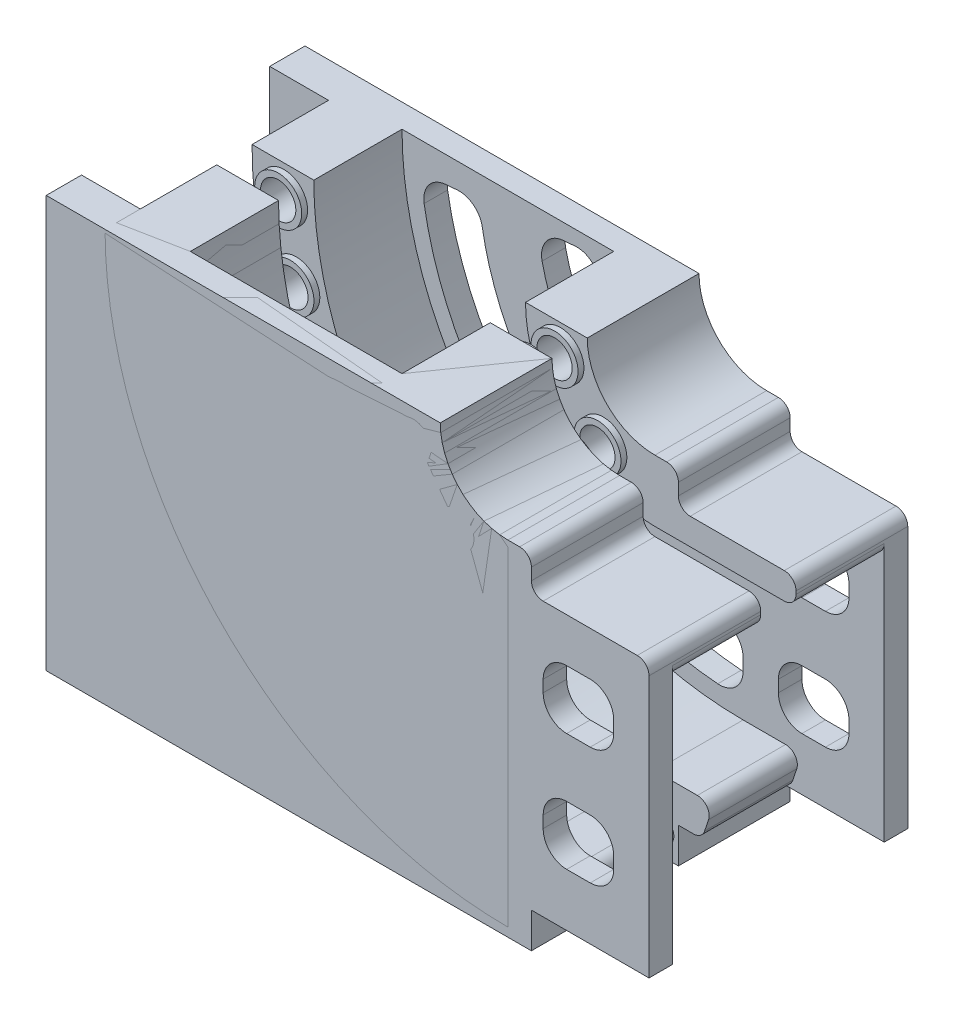
from build123d import *

# Parameters (mm, degrees)
SKETCH_2_W                = 28.5
SKETCH_2_H                = 22
SKETCH_2_W_2              = 18
SKETCH_2_H_2              = 18
SKETCH_3_W                = 51.015674508
SKETCH_3_H                = 3
CUT_EXTRUDE_1_DEPTH       = 50
SKETCH_5_R                = 2
SKETCH_5_R_2              = 1.5
EXTRUDE_1_DEPTH           = 0.5
SKETCH_7_R                = 1.5
CUT_EXTRUDE_3_DEPTH       = 10
EXTRUDE_3_DEPTH           = 2
EXTRUDE_4_DEPTH           = 3
EXTRUDE_5_DEPTH           = 6.5
SKETCH_22_R               = 1.25
CUT_EXTRUDE_8_DEPTH       = 6
EXTRUDE_12_DEPTH          = 10
SKETCH_32_W               = 10
SKETCH_32_H               = 3
CUT_EXTRUDE_11_DEPTH      = 30
CUT_EXTRUDE_13_DEPTH      = 53.952809179
CUT_EXTRUDE_13_DEPTH_BACK = 53.952809179
SKETCH_34_W               = 6
SKETCH_34_H               = 5
FILLET_8_R                = 2
FILLET_9_R                = 2
FILLET_10_R               = 1
FILLET_11_R               = 1
FILLET_12_R               = 1
SKETCH_36_W               = 37.65221949
SKETCH_36_H               = 1
CUT_EXTRUDE_14_DEPTH      = 53.952809179
CUT_EXTRUDE_15_DEPTH      = 18
FILLET_13_R               = 1
FILLET_14_R               = 1
EXTRUDE_14_DEPTH          = 3
EXTRUDE_15_DEPTH          = 3


with BuildPart() as part:
    # 扫描1: sweep along a path in 草图1
    with BuildLine(Plane.XY) as sweep_1_path:
        Line((0, 0), (0, -1))
        ThreePointArc((0, -1), (5.857864376, -15.142135624), (20, -21))
    # 草图2 → 扫描1 (sweep)
    with BuildSketch(Plane(origin=(0, 0, 0), x_dir=(1, 0, 0), z_dir=(0, 1, 0))):
        Rectangle(SKETCH_2_W, SKETCH_2_H)
        Rectangle(SKETCH_2_W_2, SKETCH_2_H_2, mode=Mode.SUBTRACT)
    sweep(path=sweep_1_path.line)

    # 草图3 → 切除-拉伸1 (cut)
    with BuildSketch(Plane(origin=(0, 0, 0), x_dir=(1, 0, 0), z_dir=(0, 1, 0))):
        with Locations((9.015649399, 0)):
            Rectangle(SKETCH_3_W, SKETCH_3_H)
    extrude(amount=-CUT_EXTRUDE_1_DEPTH, mode=Mode.SUBTRACT)


with BuildPart() as cut_extrude_1_piece_1:
    # of the separate pieces the step leaves, piece 1, a body of its own (cut_extrude_1_pieces)
    add(part.part.solids().sort_by_distance((-14.25, 0, 11))[0])

    # 圆角11
    fillet_11_edges = [cut_extrude_1_piece_1.edges().sort_by_distance(p)[0] for p in [
        (14.25, 0, 6.25),
    ]]
    fillet(fillet_11_edges, radius=FILLET_11_R - 0.0001)  # a hair under: the kernel refuses the full size


with BuildPart() as cut_extrude_1_piece_2:
    # of the separate pieces the step leaves, piece 2, a body of its own (cut_extrude_1_pieces)
    add(part.part.solids().sort_by_distance((-14.25, 0, -11))[0])

    # 草图5 → 凸台-拉伸1 (add)
    # profile 1 of 11: a face of its own
    with BuildSketch(Plane.XY.offset(-1.5)):
        with Locations(Location((-11.527295675, -3.483999276, 0), (0, 0, 180))):
            Circle(SKETCH_5_R)
        with Locations((-11.527295675, -3.483999276)):
            Circle(SKETCH_5_R_2, mode=Mode.SUBTRACT)
    # profile 2 of 11: a face of its own
    with BuildSketch(Plane.XY.offset(-1.5)):
        with Locations(Location((11.967385974, -3.370176557, 0), (0, 0, 180))):
            Circle(SKETCH_5_R)
        with Locations((11.967385974, -3.370176557)):
            Circle(SKETCH_5_R_2, mode=Mode.SUBTRACT)
    # profile 3 of 11: a face of its own
    with BuildSketch(Plane.XY.offset(-1.5)):
        with Locations(Location((15.614131769, -8.134758921, 0), (0, 0, 180))):
            Circle(SKETCH_5_R)
        with Locations((15.614131769, -8.134758921)):
            Circle(SKETCH_5_R_2, mode=Mode.SUBTRACT)
    # profile 4 of 11: a face of its own
    with BuildSketch(Plane.XY.offset(-1.5)):
        with Locations(Location((14.895798215, -32.210378869, 0), (0, 0, 180))):
            Circle(SKETCH_5_R)
        with Locations((14.895798215, -32.210378869)):
            Circle(SKETCH_5_R_2, mode=Mode.SUBTRACT)
    # profile 5 of 11: a face of its own
    with BuildSketch(Plane.XY.offset(-1.5)):
        with Locations(Location((9.093026703, -30.684651901, 0), (0, 0, 180))):
            Circle(SKETCH_5_R)
        with Locations((9.093026703, -30.684651901)):
            Circle(SKETCH_5_R_2, mode=Mode.SUBTRACT)
    # profile 6 of 11: a face of its own
    with BuildSketch(Plane.XY.offset(-1.5)):
        with Locations(Location((3.682851021, -28.090427723, 0), (0, 0, 180))):
            Circle(SKETCH_5_R)
        with Locations((3.682851021, -28.090427723)):
            Circle(SKETCH_5_R_2, mode=Mode.SUBTRACT)
    # profile 7 of 11: a face of its own
    with BuildSketch(Plane.XY.offset(-1.5)):
        with Locations(Location((-1.139989892, -24.521085272, 0), (0, 0, 180))):
            Circle(SKETCH_5_R)
        with Locations((-1.139989892, -24.521085272)):
            Circle(SKETCH_5_R_2, mode=Mode.SUBTRACT)
    # profile 8 of 11: a face of its own
    with BuildSketch(Plane.XY.offset(-1.5)):
        with Locations(Location((-5.201898175, -20.10510281, 0), (0, 0, 180))):
            Circle(SKETCH_5_R)
        with Locations((-5.201898175, -20.10510281)):
            Circle(SKETCH_5_R_2, mode=Mode.SUBTRACT)
    # profile 9 of 11: a face of its own
    with BuildSketch(Plane.XY.offset(-1.5)):
        with Locations(Location((-8.35666569, -15.001433353, 0), (0, 0, 180))):
            Circle(SKETCH_5_R)
        with Locations((-8.35666569, -15.001433353)):
            Circle(SKETCH_5_R_2, mode=Mode.SUBTRACT)
    # profile 10 of 11: a face of its own
    with BuildSketch(Plane.XY.offset(-1.5)):
        with Locations(Location((-10.490736776, -9.393783168, 0), (0, 0, 180))):
            Circle(SKETCH_5_R)
        with Locations((-10.490736776, -9.393783168)):
            Circle(SKETCH_5_R_2, mode=Mode.SUBTRACT)
    # profile 11 of 11: a face of its own
    with BuildSketch(Plane.XY.offset(-1.5)):
        with Locations((28.35074506, -0.363068339)):
            Circle(SKETCH_5_R_2)
    extrude(amount=EXTRUDE_1_DEPTH)


with BuildPart() as extrude_1_kept_piece:
    # of the separate pieces the step leaves, the one the design keeps (extrude_1_pieces_kept)
    add(cut_extrude_1_piece_2.part.solids().sort_by_distance((-14.25, 0, -11))[0])

    # 草图7 → 切除-拉伸3 (cut)
    with BuildSketch(Plane.XY.offset(-1.5)):
        with Locations((11.967385974, -3.370176557)):
            Circle(SKETCH_7_R)
        with Locations((15.614131769, -8.134758921)):
            Circle(SKETCH_7_R)
        with Locations((14.895798215, -32.210378869)):
            Circle(SKETCH_7_R)
        with Locations((9.093026703, -30.684651901)):
            Circle(SKETCH_7_R)
        with Locations((3.682851021, -28.090427723)):
            Circle(SKETCH_7_R)
        with Locations((-1.139989892, -24.521085272)):
            Circle(SKETCH_7_R)
        with Locations((-5.201898175, -20.10510281)):
            Circle(SKETCH_7_R)
        with Locations((-8.35666569, -15.001433353)):
            Circle(SKETCH_7_R)
        with Locations((-10.490736776, -9.393783168)):
            Circle(SKETCH_7_R)
        with Locations((-11.527295675, -3.483999276)):
            Circle(SKETCH_7_R)
    extrude(amount=-CUT_EXTRUDE_3_DEPTH, mode=Mode.SUBTRACT)

    # 草图18 → 凸台-拉伸3 (add)
    with BuildSketch(Plane(origin=(20, 0, 0), x_dir=(0, 0, -1), z_dir=(1, 0, 0))):
        Polygon((1.5, -30), (1.5, -35.25), (11, -35.25), (11, -6.75), (1.5, -6.75), (1.5, -12), (9, -12), (9, -30), align=None)
    extrude(amount=EXTRUDE_3_DEPTH)

    # 草图19 → 凸台-拉伸4 (add)
    with BuildSketch(Plane(origin=(0, 0, -11), x_dir=(-1, 0, 0), z_dir=(0, 0, -1))):
        with BuildLine():
            Line((19.25, 0), (14.25, 0))
            Line((14.25, 0), (14.25, -1))
            ThreePointArc((14.25, -1), (4.218407256, -25.218407256), (-20, -35.25))
            Line((-20, -35.25), (-22, -35.25))
            Line((-22, -35.25), (-22, -36))
            Line((-22, -36), (19.25, -36))
            Line((19.25, -36), (19.25, 0))
        make_face()
    extrude(amount=-EXTRUDE_4_DEPTH)

    # 草图21 → 凸台-拉伸5 (add)
    with BuildSketch(Plane.XY.offset(-8)):
        with BuildLine():
            Line((-3.410734717, -26), (-19.25, -26))
            Line((-19.25, -26), (-19.25, -36))
            Line((-19.25, -36), (22, -36))
            Line((22, -36), (22, -35.25))
            Line((22, -35.25), (20, -35.25))
            ThreePointArc((20, -35.25), (7.414045527, -32.853669333), (-3.410734717, -26))
        make_face()
    extrude(amount=EXTRUDE_5_DEPTH)

    # 草图22 → 切除-拉伸8 (cut)
    with BuildSketch(Plane.XZ.offset(36)):
        with Locations(Location((5.75, -6.25, 0), (0, 0, 270))):
            Circle(SKETCH_22_R)
        with Locations(Location((-14.25, -6.25, 0), (0, 0, 270))):
            Circle(SKETCH_22_R)
    extrude(amount=-CUT_EXTRUDE_8_DEPTH, mode=Mode.SUBTRACT)


with BuildPart() as body_3:
    # 镜向1: mirrored copy
    add(extrude_1_kept_piece.part.mirror(Plane.XY))


with BuildPart() as extrude_1_kept_piece_1:
    add(extrude_1_kept_piece.part)

    add(body_3.part)  # 凸台-拉伸12 merges body 3
    # 草图31 → 凸台-拉伸12 (add)
    with BuildSketch(Plane(origin=(22, 0, 0), x_dir=(0, 0, -1), z_dir=(1, 0, 0))):
        Polygon((9, -30), (1.5, -30), (1.5, -36), (11, -36), (11, -6.75), (1.5, -6.75), (1.5, -12), (9, -12), align=None)
        Polygon((-1.5, -30), (-9, -30), (-9, -12), (-1.5, -12), (-1.5, -6.75), (-11, -6.75), (-11, -36), (-1.5, -36), align=None)
    extrude(amount=EXTRUDE_12_DEPTH)

    # 草图32 → 切除-拉伸11 (cut)
    with BuildSketch(Plane.XY.offset(11)):
        with Locations((27, -34.5)):
            Rectangle(SKETCH_32_W, SKETCH_32_H)
        with Locations((27, -8.25)):
            Rectangle(SKETCH_32_W, SKETCH_32_H)
    extrude(amount=-CUT_EXTRUDE_11_DEPTH, mode=Mode.SUBTRACT)

    # 草图34 → 切除-拉伸13 (cut, two sides: drawn at the far end of the back side and taken through both)
    with BuildSketch(Plane.XY.offset(11).offset(-CUT_EXTRUDE_13_DEPTH_BACK)):
        with BuildLine():
            ThreePointArc((9.760599446, -8.169705454), (8.25384224, -5.275251792), (7.547566274, -2.089446784))
            Line((7.547566274, -2.089446784), (2.566592783, -2.525225498))
            ThreePointArc((2.566592783, -2.525225498), (3.555379136, -6.985352508), (5.664839225, -11.037587636))
            Line((5.664839225, -11.037587636), (9.760599446, -8.169705454))
        make_face()
        with BuildLine():
            ThreePointArc((1.569079003, -13.905469818), (-1.143083968, -8.695453225), (-2.414380707, -2.961004212))
            Line((-2.414380707, -2.961004212), (-7.395354198, -3.396782926))
            ThreePointArc((-7.395354198, -3.396782926), (-5.841547072, -10.405553941), (-2.526681218, -16.773352))
            Line((-2.526681218, -16.773352), (1.569079003, -13.905469818))
        make_face()
        with BuildLine():
            Line((20, -28.5), (20, -23.5))
            ThreePointArc((20, -23.5), (13.234119511, -22.458631392), (7.094530182, -19.430920997))
            Line((7.094530182, -19.430920997), (4.226648, -23.526681218))
            ThreePointArc((4.226648, -23.526681218), (11.730590514, -27.227216146), (20, -28.5))
        make_face()
        with BuildLine():
            Line((20, -18.5), (20, -13.5))
            ThreePointArc((20, -13.5), (16.241177506, -12.921461884), (12.830294546, -11.239400554))
            Line((12.830294546, -11.239400554), (9.962412364, -15.335160775))
            ThreePointArc((9.962412364, -15.335160775), (14.737648509, -17.690046638), (20, -18.5))
        make_face()
        with Locations((26, -16)):
            Rectangle(SKETCH_34_W, SKETCH_34_H)
        with Locations((26, -26)):
            Rectangle(SKETCH_34_W, SKETCH_34_H)
    extrude(amount=CUT_EXTRUDE_13_DEPTH + CUT_EXTRUDE_13_DEPTH_BACK, mode=Mode.SUBTRACT)

    # 圆角8
    fillet_8_edges = [extrude_1_kept_piece_1.edges().sort_by_distance(p)[0] for p in [
        (7.547566274, -2.089446784, 10),
        (-7.395354198, -3.396782926, 10),
        (-2.526681218, -16.773352, 10),
        (-2.414380707, -2.961004212, 10),
        (2.566592783, -2.525225498, 10),
        (5.664839225, -11.037587636, 10),
        (9.760599446, -8.169705454, 10),
        (29, -28.5, 10),
        (29, -23.5, 10),
        (23, -23.5, 10),
        (23, -28.5, 10),
        (29, -18.5, 10),
        (29, -13.5, 10),
        (23, -13.5, 10),
        (23, -18.5, 10),
        (20, -18.5, 10),
        (20, -13.5, 10),
        (12.830294546, -11.239400554, 10),
        (9.962412364, -15.335160775, 10),
        (20, -28.5, 10),
        (20, -23.5, 10),
        (7.094530182, -19.430920997, 10),
        (4.226648, -23.526681218, 10),
        (1.569079003, -13.905469818, 10),
    ]]
    fillet(fillet_8_edges, radius=FILLET_8_R)

    # 圆角9
    fillet_9_edges = [extrude_1_kept_piece_1.edges().sort_by_distance(p)[0] for p in [
        (2.566592783, -2.525225498, -10),
        (7.547566274, -2.089446784, -10),
        (9.760599446, -8.169705454, -10),
        (5.664839225, -11.037587636, -10),
        (-7.395354198, -3.396782926, -10),
        (-2.414380707, -2.961004212, -10),
        (1.569079003, -13.905469818, -10),
        (-2.526681218, -16.773352, -10),
        (4.226648, -23.526681218, -10),
        (7.094530182, -19.430920997, -10),
        (20, -23.5, -10),
        (20, -28.5, -10),
        (9.962412364, -15.335160775, -10),
        (12.830294546, -11.239400554, -10),
        (20, -13.5, -10),
        (20, -18.5, -10),
        (23, -18.5, -10),
        (23, -13.5, -10),
        (29, -13.5, -10),
        (29, -18.5, -10),
        (23, -28.5, -10),
        (23, -23.5, -10),
        (29, -23.5, -10),
        (29, -28.5, -10),
    ]]
    fillet(fillet_9_edges, radius=FILLET_9_R)

    # 圆角10
    fillet_10_edges = [extrude_1_kept_piece_1.edges().sort_by_distance(p)[0] for p in [
        (14.25, 0, -6.25),
        (32, -12, -5.25),
        (32, -9.75, -6.25),
        (22, -9.75, -6.25),
        (22, -6.75, -6.25),
    ]]
    fillet(fillet_10_edges, radius=FILLET_10_R - 0.0001)  # a hair under: the kernel refuses the full size

    # 圆角12
    fillet_12_edges = [extrude_1_kept_piece_1.edges().sort_by_distance(p)[0] for p in [
        (9, 0, 5.25),
        (14.25, 0, 6.25),
        (32, -12, 5.25),
        (32, -9.75, 6.25),
        (22, -9.75, 6.25),
        (22, -6.75, 6.25),
    ]]
    fillet(fillet_12_edges, radius=FILLET_12_R - 0.0001)  # a hair under: the kernel refuses the full size


with BuildPart() as cut_extrude_14_tool:
    # 草图36 → 切除-拉伸14 (new, through all)
    with BuildSketch(Plane(origin=(0, 0, -11), x_dir=(-1, 0, 0), z_dir=(0, 0, -1))):
        with Locations((0.423890255, -0.5)):
            Rectangle(SKETCH_36_W, SKETCH_36_H)
    extrude(amount=-CUT_EXTRUDE_14_DEPTH)


with BuildPart() as cut_extrude_1_piece_1_1:
    add(cut_extrude_1_piece_1.part)

    # 切除-拉伸14: cut by cut_extrude_14_tool
    add(cut_extrude_14_tool.part, mode=Mode.SUBTRACT)


with BuildPart() as extrude_1_kept_piece_2:
    add(extrude_1_kept_piece_1.part)

    # 切除-拉伸14: cut by cut_extrude_14_tool
    add(cut_extrude_14_tool.part, mode=Mode.SUBTRACT)

    # 草图39 → 切除-拉伸15 (cut)
    with BuildSketch(Plane.XY.offset(-9)):
        Polygon((32, -30), (25, -30), (24, -33), (32, -33), align=None)
    extrude(amount=CUT_EXTRUDE_15_DEPTH, mode=Mode.SUBTRACT)

    # 圆角13
    fillet_13_edges = [extrude_1_kept_piece_2.edges().sort_by_distance(p)[0] for p in [
        (24, -33, 5.25),
        (25, -30, 5.25),
    ]]
    fillet(fillet_13_edges, radius=FILLET_13_R)

    # 圆角14
    fillet_14_edges = [extrude_1_kept_piece_2.edges().sort_by_distance(p)[0] for p in [
        (24, -33, -5.25),
        (25, -30, -5.25),
    ]]
    fillet(fillet_14_edges, radius=FILLET_14_R)

    # 草图40 → 凸台-拉伸14 (add)
    with BuildSketch(Plane(origin=(0, 0, -11), x_dir=(-1, 0, 0), z_dir=(0, 0, -1))):
        with BuildLine():
            Line((9.625, -1), (13.625, -1))
            ThreePointArc((13.625, -1), (3.776465517, -24.776465517), (-20, -34.625))
            Line((-20, -34.625), (-20, -30.625))
            ThreePointArc((-20, -30.625), (0.948038393, -21.948038393), (9.625, -1))
        make_face()
    extrude(amount=-EXTRUDE_14_DEPTH)

    # 草图41 → 凸台-拉伸15 (add)
    with BuildSketch(Plane.XY.offset(11)):
        with BuildLine():
            ThreePointArc((-9.625, -1), (-0.948038393, -21.948038393), (20, -30.625))
            Line((20, -30.625), (20, -34.625))
            ThreePointArc((20, -34.625), (-3.776465517, -24.776465517), (-13.625, -1))
            Line((-13.625, -1), (-9.625, -1))
        make_face()
    extrude(amount=-EXTRUDE_15_DEPTH)


solid = Compound([cut_extrude_1_piece_1_1.part, extrude_1_kept_piece_2.part])
